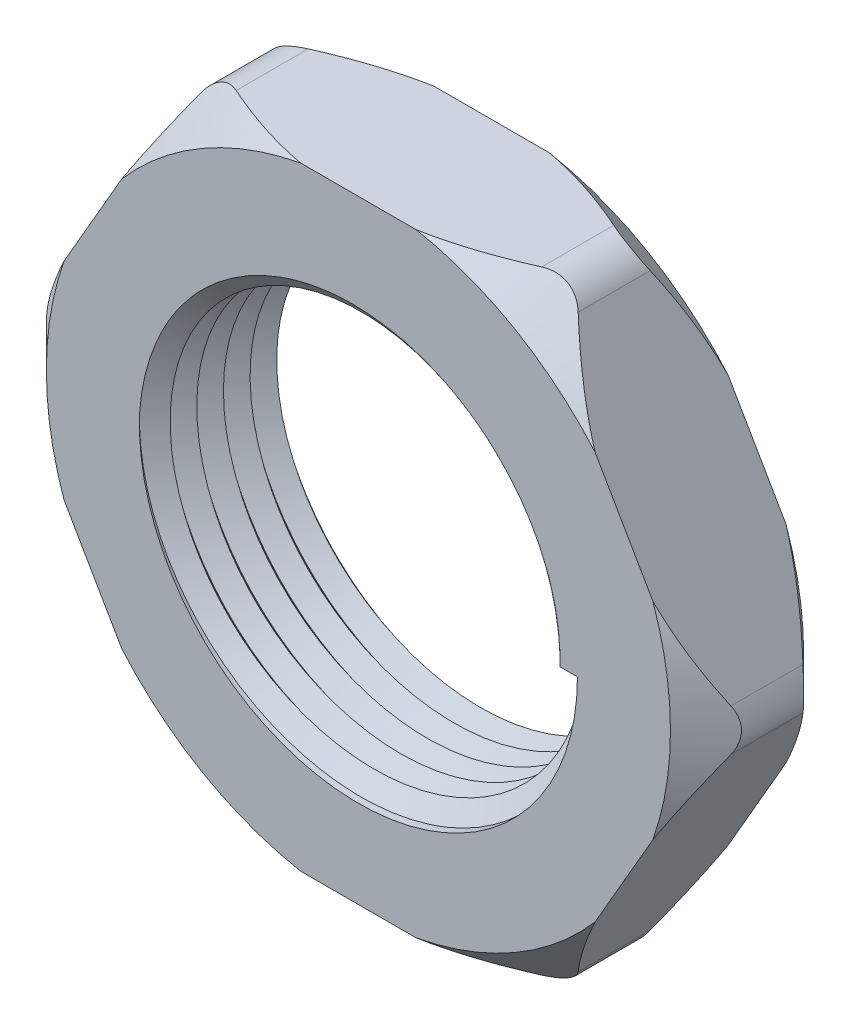
from build123d import *

# Parameters (mm, degrees)
SKETCH1_R           = 7.9375
BOSS_EXTRUDE1_DEPTH = 4.826
FILLET2_R           = 1.524
SWEEP1_PITCH        = 0.9652
SKETCH7_W           = 21.90613394
SKETCH7_H           = 1.338715942
SKETCH7_W_2         = 20.537000569
SKETCH7_H_2         = 1.748623727
CUT_EXTRUDE1_DEPTH  = 12.7


with BuildPart() as part:
    # Sketch1 → Boss-Extrude1 (new body)
    with BuildSketch(Plane.XY):
        Polygon((12.831609733, 0), (6.415804866, 11.1125), (-6.415804866, 11.1125), (-12.831609733, 0), (-6.415804866, -11.1125), (6.415804866, -11.1125), align=None)
        Circle(SKETCH1_R, mode=Mode.SUBTRACT)
    extrude(amount=BOSS_EXTRUDE1_DEPTH)

    # Sketch2 → Cut-Revolve1 (revolve, cut)
    with BuildSketch(Plane(origin=(0, 0, 0), x_dir=(1, 0, 0), z_dir=(0, 1, 0))):
        Polygon((11.307609733, 0), (12.831609733, -1.524), (13.372866679, -1.524), (13.372866679, 0.954530973), (11.307609733, 0.954530973), align=None)
        Polygon((12.831609733, -3.302), (11.307609733, -4.826), (11.307609733, -5.661497247), (13.198126929, -5.661497247), (13.198126929, -3.302), align=None)
    revolve(axis=Axis((0, 0, 0), (0, 0, 1)), mode=Mode.SUBTRACT)

    # Fillet2
    fillet2_edges = [part.edges().sort_by_distance(p)[0] for p in [
        (-12.831609733, 0, 2.413),
        (-6.415804866, -11.1125, 2.413),
        (6.415804866, -11.1125, 2.413),
        (12.831609733, 0, 2.413),
        (6.415804866, 11.1125, 2.413),
        (-6.415804866, 11.1125, 2.413),
    ]]
    fillet(fillet2_edges, radius=FILLET2_R)

    # Sweep1: arcs per turn and ends read off the stored shape
    # Sweep1: the profile of Sketch6 profile screwed along a left-hand helix through 5 turns, 8 arcs to a turn; built about Z, then put on its axis
    sweep1_z = Axis((0, 0, 0), (0, 0, 1))
    sweep1_corners = [(7.937799997, 0.009219609, 0.476385792), (7.3025, 0, 0), (7.937799997, -0.009219609, -0.476385792)]
    with BuildLine(mode=Mode.PRIVATE) as sweep1_profile:
        Line(sweep1_corners[0], sweep1_corners[1])
        Line(sweep1_corners[1], sweep1_corners[2])
        Line(sweep1_corners[2], sweep1_corners[0])
    sweep1_cap = Face(sweep1_profile.wire())
    sweep1_turn_angles = [0, -22.5, -45, -67.5, -90, -112.5, -135, -157.5, -180, -202.5, -225, -247.5, -270, -292.5, -315, -337.5, -360]
    sweep1_turn_weights = [1, 0.9238795325112867, 1, 0.9238795325112867, 1, 0.9238795325112867, 1, 0.9238795325112867, 1, 0.9238795325112867, 1, 0.9238795325112867, 1, 0.9238795325112867, 1, 0.9238795325112867, 1]
    sweep1_turn_rails = [Edge.make_bspline([Vector(p[0], p[1], 0).rotate(sweep1_z, sweep1_turn_angles[k]) / sweep1_turn_weights[k] + Vector(0, 0, p[2] + -SWEEP1_PITCH * sweep1_turn_angles[k] / 360) for k in range(17)], [0, 0, 0, 1, 1, 2, 2, 3, 3, 4, 4, 5, 5, 6, 6, 7, 7, 8, 8, 8], 2, sweep1_turn_weights) for p in sweep1_corners]
    sweep1_turn_sides = [Face.make_surface_from_curves(sweep1_turn_rails[p[0]], sweep1_turn_rails[p[1]]) for p in [(0, 1), (1, 2), (2, 0)]]
    sweep1 = Plane(origin=(0, 0, 0), x_dir=(1, 0, 0), z_dir=(0, 0, 1)) * Solid(Shell([*[p.moved(Location((0, 0, SWEEP1_PITCH * i))) for i in range(5) for p in sweep1_turn_sides], sweep1_cap, sweep1_cap.rotate(sweep1_z, -1800).moved(Location((0, 0, -SWEEP1_PITCH * -1800 / 360)))]))
    add(sweep1)

    # Sketch7 → Cut-Extrude1 (cut, symmetric)
    with BuildSketch(Plane(origin=(0, 0, 0), x_dir=(1, 0, 0), z_dir=(0, 1, 0))):
        with Locations((0.906240161, 0.669357971)):
            Rectangle(SKETCH7_W, SKETCH7_H)
        with Locations((-0.155152224, -5.700311864)):
            Rectangle(SKETCH7_W_2, SKETCH7_H_2)
    extrude(amount=CUT_EXTRUDE1_DEPTH, both=True, mode=Mode.SUBTRACT)


solid = part.part
